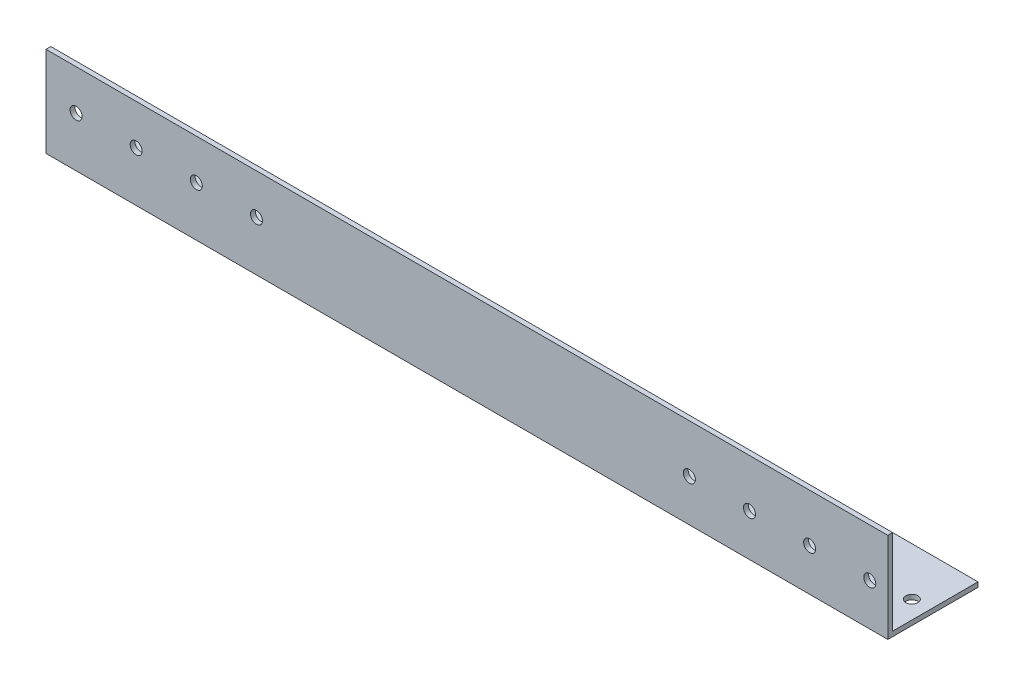
from build123d import *

# Parameters (mm, degrees)
EXTRUDE_1_DEPTH     = 700
SKETCH_2_R          = 5
CUT_EXTRUDE_1_DEPTH = 10
SKETCH_3_R          = 5
CUT_EXTRUDE_2_DEPTH = 10


with BuildPart() as part:
    # Эскиз1 → Вытянуть-Тонкостенный1 (new body)
    with BuildSketch(Plane(origin=(0, 0, 0), x_dir=(0, 0, -1), z_dir=(1, 0, 0))):
        Polygon((75, 0), (0, 0), (0, 75), (4, 75), (4, 4), (75, 4), align=None)
    extrude(amount=EXTRUDE_1_DEPTH)

    # Эскиз2 → Вырез-Вытянуть1 (cut)
    with BuildSketch(Plane.XY):
        with Locations((25, 41.5)):
            Circle(SKETCH_2_R)
        with Locations((75, 41.5)):
            Circle(SKETCH_2_R)
        with Locations((125, 41.5)):
            Circle(SKETCH_2_R)
        with Locations((175, 41.5)):
            Circle(SKETCH_2_R)
        with Locations((535, 35)):
            Circle(SKETCH_2_R)
        with Locations((585, 35)):
            Circle(SKETCH_2_R)
        with Locations((635, 35)):
            Circle(SKETCH_2_R)
        with Locations((685, 35)):
            Circle(SKETCH_2_R)
    extrude(amount=-CUT_EXTRUDE_1_DEPTH, mode=Mode.SUBTRACT)

    # Эскиз3 → Вырез-Вытянуть2 (cut)
    with BuildSketch(Plane.XZ):
        with Locations((25, -41.5)):
            Circle(SKETCH_3_R)
        with Locations((75, -41.5)):
            Circle(SKETCH_3_R)
        with Locations((125, -41.5)):
            Circle(SKETCH_3_R)
        with Locations((175, -41.5)):
            Circle(SKETCH_3_R)
        with Locations((535, -35)):
            Circle(SKETCH_3_R)
        with Locations((585, -35)):
            Circle(SKETCH_3_R)
        with Locations((635, -35)):
            Circle(SKETCH_3_R)
        with Locations((685, -35)):
            Circle(SKETCH_3_R)
    extrude(amount=-CUT_EXTRUDE_2_DEPTH, mode=Mode.SUBTRACT)


solid = part.part
